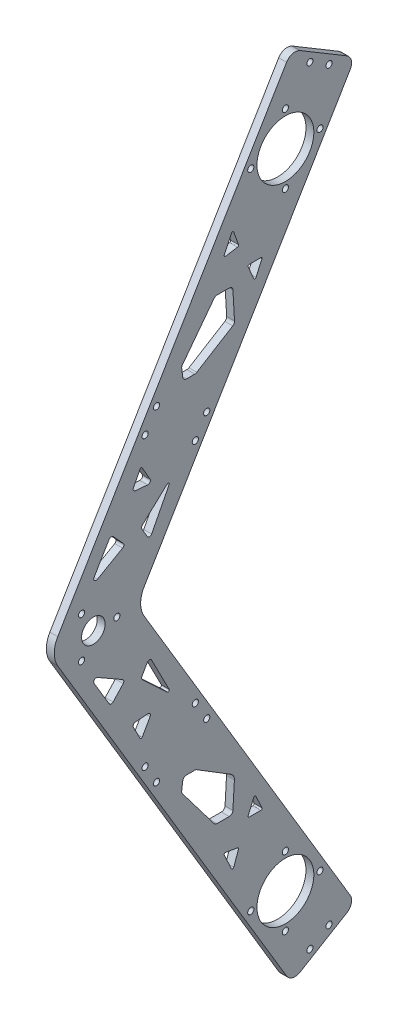
from build123d import *

# Parameters (mm, degrees)
EXTRUDE_BASE_DEPTH         = 3.18
SKETCH4_R                  = 11.5
CUT_MOTOR_HOLES_DEPTH      = 3.18
SKETCH5_R                  = 1.25
MOTOR_SUPPORT_HOLES_DEPTH  = 3.18
SKETCH6_R                  = 1.25
SKETCH6_R_2                = 4.765
SUPPORT_HOLES_DEPTH        = 3.18
CUT_LIGHTENING_HOLES_DEPTH = 3.18


with BuildPart() as part:
    # bogie base → extrude-base (new body)
    with BuildSketch(Plane.YZ):
        with BuildLine():
            Line((-31.39506552, -5.945574909), (-20.11035906, -24.830897255))
            ThreePointArc((-20.11035906, -24.830897255), (-17.653836276, -26.657938255), (-14.624899277, -26.212827416))
            Line((-14.624899277, -26.212827416), (124.870587973, 57.141091427))
            ThreePointArc((124.870587973, 57.141091427), (130, 58.556853997), (135.129412027, 57.141091427))
            Line((135.129412027, 57.141091427), (274.624899277, -26.212827416))
            ThreePointArc((274.624899277, -26.212827416), (277.653836276, -26.657938255), (280.11035906, -24.830897255))
            Line((280.11035906, -24.830897255), (291.39506552, -5.945574909))
            ThreePointArc((291.39506552, -5.945574909), (291.840176358, -2.91663791), (290.013135359, -0.460115126))
            Line((290.013135359, -0.460115126), (135.129412027, 92.088866631))
            ThreePointArc((135.129412027, 92.088866631), (130, 93.504629201), (124.870587973, 92.088866631))
            Line((124.870587973, 92.088866631), (-30.013135359, -0.460115126))
            ThreePointArc((-30.013135359, -0.460115126), (-31.840176358, -2.91663791), (-31.39506552, -5.945574909))
        make_face()
    extrude(amount=EXTRUDE_BASE_DEPTH)

    # Sketch4 → Cut-motor holes (cut)
    with BuildSketch(Plane.YZ):
        with Locations((260, 0)):
            Circle(SKETCH4_R)
        Circle(SKETCH4_R)
    extrude(amount=CUT_MOTOR_HOLES_DEPTH, mode=Mode.SUBTRACT)

    # Sketch5 → motor support holes (cut)
    with BuildSketch(Plane.YZ):
        with Locations((0, 14)):
            Circle(SKETCH5_R)
        with Locations((0, -14)):
            Circle(SKETCH5_R)
        with Locations((14, 0)):
            Circle(SKETCH5_R)
        with Locations((-14, 0)):
            Circle(SKETCH5_R)
        with Locations((274, 0)):
            Circle(SKETCH5_R)
        with Locations((246, 0)):
            Circle(SKETCH5_R)
        with Locations((260, -14)):
            Circle(SKETCH5_R)
        with Locations((260, 14)):
            Circle(SKETCH5_R)
    extrude(amount=MOTOR_SUPPORT_HOLES_DEPTH, mode=Mode.SUBTRACT)

    # Sketch6 → support holes (cut)
    with BuildSketch(Plane.YZ):
        with Locations((-25.331160199, -9.894176214)):
            Circle(SKETCH6_R)
        with Locations((-20.714689375, -17.619989901)):
            Circle(SKETCH6_R)
        with Locations((64.164835578, 52.110380567)):
            Circle(SKETCH6_R)
        with Locations((71.890649265, 56.726851391)):
            Circle(SKETCH6_R)
        with Locations((76.290765611, 31.817243282)):
            Circle(SKETCH6_R)
        with Locations((84.016579298, 36.433714107)):
            Circle(SKETCH6_R)
        with Locations((130, 77.68)):
            Circle(SKETCH6_R_2)
        with Locations((130, 68.17)):
            Circle(SKETCH6_R)
        with Locations((121.77231361, 82.449200841)):
            Circle(SKETCH6_R)
        with Locations((138.248750332, 82.43704307)):
            Circle(SKETCH6_R)
        with Locations((175.983420702, 36.433714107)):
            Circle(SKETCH6_R)
        with Locations((183.709234389, 31.817243282)):
            Circle(SKETCH6_R)
        with Locations((195.835164422, 52.110380567)):
            Circle(SKETCH6_R)
        with Locations((188.109350735, 56.726851391)):
            Circle(SKETCH6_R)
        with Locations((280.714689375, -17.619989901)):
            Circle(SKETCH6_R)
        with Locations((285.331160199, -9.894176214)):
            Circle(SKETCH6_R)
    extrude(amount=SUPPORT_HOLES_DEPTH, mode=Mode.SUBTRACT)

    # Sketch7 → Cut-lightening holes (cut)
    with BuildSketch(Plane.YZ):
        with BuildLine():
            Line((111.42043569, 77.388527345), (101.209317413, 71.28699144))
            ThreePointArc((101.209317413, 71.28699144), (100.727850707, 70.534175036), (101.040461204, 69.69702666))
            Line((101.040461204, 69.69702666), (105.428199491, 65.607647583))
            ThreePointArc((105.428199491, 65.607647583), (106.26014363, 65.350524896), (106.978240045, 65.843049682))
            Line((106.978240045, 65.843049682), (112.801620035, 76.033964664))
            ThreePointArc((112.801620035, 76.033964664), (112.633569639, 77.244057465), (111.42043569, 77.388527345))
        make_face()
        with BuildLine():
            Line((107.969578783, 55.865728859), (104.151056432, 58.047741631))
            ThreePointArc((104.151056432, 58.047741631), (103.504770767, 58.168162214), (102.923376457, 57.861295901))
            Line((102.923376457, 57.861295901), (93.555977978, 47.810456351))
            ThreePointArc((93.555977978, 47.810456351), (93.523007821, 47.167885846), (94.150326519, 47.024864393))
            Line((94.150326519, 47.024864393), (107.930595889, 54.108099215))
            ThreePointArc((107.930595889, 54.108099215), (108.473193975, 54.975311928), (107.969578783, 55.865728859))
        make_face()
        with BuildLine():
            Line((88.049719247, 61.454740836), (82.859926163, 58.78712077))
            ThreePointArc((82.859926163, 58.78712077), (82.58862712, 58.353514413), (82.840434716, 57.908305947))
            Line((82.840434716, 57.908305947), (88.39442422, 54.734597659))
            ThreePointArc((88.39442422, 54.734597659), (89.425478014, 54.757934832), (89.887587515, 55.679927976))
            Line((89.887587515, 55.679927976), (89.503899648, 60.642441508))
            ThreePointArc((89.503899648, 60.642441508), (88.99454526, 61.438382398), (88.049719247, 61.454740836))
        make_face()
        with BuildLine():
            Line((54.884000108, 41.646401467), (38.03439682, 28.860792879))
            ThreePointArc((38.03439682, 28.860792879), (37.597600164, 28.332915929), (37.441118366, 27.665863577))
            Line((37.441118366, 27.665863577), (37.441118366, 22.734591544))
            ThreePointArc((37.441118366, 22.734591544), (37.849837551, 21.705462697), (38.853259944, 21.237166789))
            Line((38.853259944, 21.237166789), (49.165938422, 20.63209087))
            ThreePointArc((49.165938422, 20.63209087), (50.727348318, 20.966140733), (51.896208282, 22.053962665))
            Line((51.896208282, 22.053962665), (60.398420976, 35.861757183))
            ThreePointArc((60.398420976, 35.861757183), (60.564389902, 36.239537563), (60.621144468, 36.64824604))
            Line((60.621144468, 36.64824604), (60.621144468, 40.036157787))
            ThreePointArc((60.621144468, 40.036157787), (60.245516663, 41.02902594), (59.306761578, 41.524628912))
            Line((59.306761578, 41.524628912), (55.976338764, 41.939943289))
            ThreePointArc((55.976338764, 41.939943289), (55.401440776, 41.900078528), (54.884000108, 41.646401467))
        make_face()
        with BuildLine():
            Line((24.884516924, 24.721374833), (18.705144583, 21.831399877))
            ThreePointArc((18.705144583, 21.831399877), (18.417465284, 21.356111644), (18.746484253, 20.908445695))
            Line((18.746484253, 20.908445695), (24.138628528, 18.952747594))
            ThreePointArc((24.138628528, 18.952747594), (24.56226467, 18.991611172), (24.802638255, 19.342607608))
            Line((24.802638255, 19.342607608), (25.589866321, 24.188280664))
            ThreePointArc((25.589866321, 24.188280664), (25.397812236, 24.667348649), (24.884516924, 24.721374833))
        make_face()
        with BuildLine():
            Line((39.102419009, 11.923067743), (33.916408171, 9.497669076))
            ThreePointArc((33.916408171, 9.497669076), (33.436176226, 9.528737341), (33.204588267, 9.950584441))
            Line((33.204588267, 9.950584441), (33.204588267, 14.586181596))
            ThreePointArc((33.204588267, 14.586181596), (33.428921701, 15.003324191), (33.900620046, 15.046150661))
            Line((33.900620046, 15.046150661), (39.086630884, 12.835952174))
            ThreePointArc((39.086630884, 12.835952174), (39.390524344, 12.3846292), (39.102419009, 11.923067743))
        make_face()
        with BuildLine():
            Line((226.099379954, 15.046150661), (220.913369116, 12.835952174))
            ThreePointArc((220.913369116, 12.835952174), (220.609475656, 12.3846292), (220.897580991, 11.923067743))
            Line((220.897580991, 11.923067743), (226.083591829, 9.497669076))
            ThreePointArc((226.083591829, 9.497669076), (226.563823774, 9.528737341), (226.795411733, 9.950584441))
            Line((226.795411733, 9.950584441), (226.795411733, 14.586181596))
            ThreePointArc((226.795411733, 14.586181596), (226.571078299, 15.003324191), (226.099379954, 15.046150661))
        make_face()
        with BuildLine():
            Line((235.197361745, 19.342607608), (234.410133679, 24.188280664))
            ThreePointArc((234.410133679, 24.188280664), (234.602187764, 24.667348649), (235.115483076, 24.721374833))
            Line((235.115483076, 24.721374833), (241.294855417, 21.831399877))
            ThreePointArc((241.294855417, 21.831399877), (241.582534716, 21.356111644), (241.253515747, 20.908445695))
            Line((241.253515747, 20.908445695), (235.861371472, 18.952747594))
            ThreePointArc((235.861371472, 18.952747594), (235.43773533, 18.991611172), (235.197361745, 19.342607608))
        make_face()
        with BuildLine():
            Line((200.693238422, 41.524628912), (204.023661236, 41.939943289))
            ThreePointArc((204.023661236, 41.939943289), (204.598559224, 41.900078528), (205.115999892, 41.646401467))
            Line((205.115999892, 41.646401467), (221.96560318, 28.860792879))
            ThreePointArc((221.96560318, 28.860792879), (222.402399836, 28.332915929), (222.558881634, 27.665863577))
            Line((222.558881634, 27.665863577), (222.558881634, 22.734591544))
            ThreePointArc((222.558881634, 22.734591544), (222.150162449, 21.705462697), (221.146740056, 21.237166789))
            Line((221.146740056, 21.237166789), (209.939024731, 20.579576362))
            ThreePointArc((209.939024731, 20.579576362), (209.158319783, 20.746601293), (208.573889801, 21.290512259))
            Line((208.573889801, 21.290512259), (199.601579024, 35.861757183))
            ThreePointArc((199.601579024, 35.861757183), (199.435610098, 36.239537563), (199.378855532, 36.64824604))
            Line((199.378855532, 36.64824604), (199.378855532, 40.036157787))
            ThreePointArc((199.378855532, 40.036157787), (199.754483337, 41.02902594), (200.693238422, 41.524628912))
        make_face()
        with BuildLine():
            Line((170.112412485, 55.679927976), (170.496100352, 60.642441508))
            ThreePointArc((170.496100352, 60.642441508), (171.00545474, 61.438382398), (171.950280753, 61.454740836))
            Line((171.950280753, 61.454740836), (177.140073837, 58.78712077))
            ThreePointArc((177.140073837, 58.78712077), (177.41137288, 58.353514413), (177.159565284, 57.908305947))
            Line((177.159565284, 57.908305947), (171.60557578, 54.734597659))
            ThreePointArc((171.60557578, 54.734597659), (170.574521986, 54.757934832), (170.112412485, 55.679927976))
        make_face()
        with BuildLine():
            Line((165.849673481, 47.024864393), (152.069404111, 54.108099215))
            ThreePointArc((152.069404111, 54.108099215), (151.526806025, 54.975311928), (152.030421217, 55.865728859))
            Line((152.030421217, 55.865728859), (155.848943568, 58.047741631))
            ThreePointArc((155.848943568, 58.047741631), (156.495229233, 58.168162214), (157.076623543, 57.861295901))
            Line((157.076623543, 57.861295901), (166.444022022, 47.810456351))
            ThreePointArc((166.444022022, 47.810456351), (166.476992179, 47.167885846), (165.849673481, 47.024864393))
        make_face()
        with BuildLine():
            Line((153.021759955, 65.843049682), (147.198379965, 76.033964664))
            ThreePointArc((147.198379965, 76.033964664), (147.366430361, 77.244057465), (148.57956431, 77.388527345))
            Line((148.57956431, 77.388527345), (158.790682587, 71.28699144))
            ThreePointArc((158.790682587, 71.28699144), (159.272149293, 70.534175036), (158.959538796, 69.69702666))
            Line((158.959538796, 69.69702666), (154.571800509, 65.607647583))
            ThreePointArc((154.571800509, 65.607647583), (153.73985637, 65.350524896), (153.021759955, 65.843049682))
        make_face()
    extrude(amount=CUT_LIGHTENING_HOLES_DEPTH, mode=Mode.SUBTRACT)


solid = part.part
